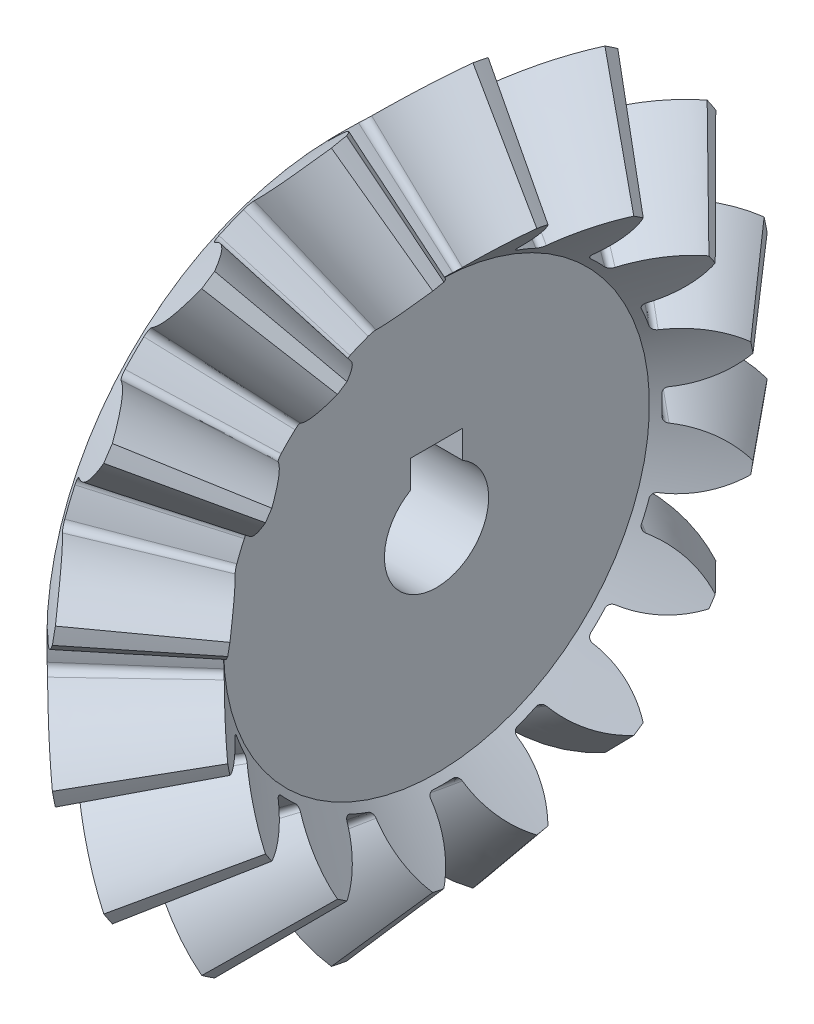
from build123d import *

# Parameters (mm, degrees)
TEETHCUTS_COUNT    = 16
TEETHCUTS_ANGLE    = 337.5
HUBSKE_R           = 27.798901836
HUB_DEPTH          = 0.0001016
BORSKE_R           = 5
BORE_DEPTH         = 36.201148964
SKETCH2_W          = 5
SKETCH2_H          = 5
CUT_EXTRUDE2_DEPTH = 50


with BuildPart() as part:
    # BasProSke → Base-Revolve (revolve)
    with BuildSketch(Plane(origin=(0, 0, 0), x_dir=(1, 0, 0), z_dir=(0, 1, 0)), mode=Mode.PRIVATE) as base_revolve_sk:
        Polygon((0, 0), (0, 27.79890184), (7.029525295, 34.828427122), (14.76480666, 25.59314574), (9.599265744, 20.427604833), (9.599265744, 0), align=None)
    revolve(base_revolve_sk.sketch.rotate(Axis((-10, 0, 0), (1, 0, 0)), 180), axis=Axis((-10, 0, 0), (1, 0, 0)))

    # ToothCut: read off the stored shape, not the designer's step
    # ToothCut: loft between two sections, ruled curve by curve
    toothcut_from = [
        Edge.make_bspline([(36.206891829, 0.005793661, -0.009703418), (36.202752871, 0.001654704, -0.014645972), (36.197364322, -0.003733846, -0.013859942), (36.194025889, -0.007072278, -0.007826658)], [0, 0, 0, 0, 1, 1, 1, 1], 3, [1, 0.79588138, 0.79588138, 1]),
        Edge.make_bspline([(36.194025889, -0.007072278, 0.007826658), (36.197364322, -0.003733846, 0.013859942), (36.202752871, 0.001654704, 0.014645972), (36.206891829, 0.005793661, 0.009703418)], [0, 0, 0, 0, 1, 1, 1, 1], 3, [1, 0.79588138, 0.79588138, 1]),
        Edge.make_bspline([(36.194025889, -0.007072278, -0.007826658), (36.193482763, -0.007615404, -0.006845109), (36.193046909, -0.008051258, -0.005761841), (36.192727687, -0.008370481, -0.004600116)], [0, 0, 0, 0, 1, 1, 1, 1], 3, [1, 0.99284125, 0.99284125, 1]),
        Edge.make_bspline([(36.192727687, -0.008370481, 0.004600116), (36.193046909, -0.008051258, 0.005761841), (36.193482763, -0.007615404, 0.006845109), (36.194025889, -0.007072278, 0.007826658)], [0, 0, 0, 0, 1, 1, 1, 1], 3, [1, 0.99284125, 0.99284125, 1]),
        Edge.make_bspline([(36.192727687, -0.008370481, -0.004600116), (36.191904976, -0.009193191, -0.001606079), (36.191904976, -0.009193191, 0.001606079), (36.192727687, -0.008370481, 0.004600116)], [0, 0, 0, 0, 1, 1, 1, 1], 3, [1, 0.954730001, 0.954730001, 1]),
        Edge.make_line((36.206891829, 0.005793661, 0.009703418), (36.206891829, 0.005793661, -0.009703418)),
    ]
    toothcut_to = [
        Edge.make_bspline([(7.109764347, 34.908666175, -6.646451093), (5.632990485, 33.431892315, -4.092410632), (3.594649708, 31.393551541, -2.487674356), (1.281610641, 29.080512478, -2.058086977)], [0, 0, 0, 0, 1, 1, 1, 1], 3, [1, 0.953087886, 0.953087886, 1]),
        Edge.make_bspline([(1.281610641, 29.080512478, 2.058086977), (3.594649708, 31.393551541, 2.487674356), (5.632990485, 33.431892315, 4.092410632), (7.109764347, 34.908666175, 6.646451093)], [0, 0, 0, 0, 1, 1, 1, 1], 3, [1, 0.953087886, 0.953087886, 1]),
        Edge.make_bspline([(1.281610641, 29.080512478, -2.058086977), (0.992514696, 28.791416534, -2.004394858), (0.805416205, 28.604318044, -1.688129016), (0.819073498, 28.617975336, -1.276227656)], [0, 0, 0, 0, 1, 1, 1, 1], 3, [1, 0.824052866, 0.824052866, 1]),
        Edge.make_bspline([(0.819073498, 28.617975336, 1.276227656), (0.805416205, 28.604318044, 1.688129016), (0.992514696, 28.791416534, 2.004394858), (1.281610641, 29.080512478, 2.058086977)], [0, 0, 0, 0, 1, 1, 1, 1], 3, [1, 0.824052866, 0.824052866, 1]),
        Edge.make_bspline([(0.819073498, 28.617975336, -1.276227656), (0.847273507, 28.646175345, -0.425720721), (0.847273507, 28.646175345, 0.425720721), (0.819073498, 28.617975336, 1.276227656)], [0, 0, 0, 0, 1, 1, 1, 1], 3, [1, 0.999268295, 0.999268295, 1]),
        Edge.make_line((7.109764347, 34.908666175, 6.646451093), (7.109764347, 34.908666175, -6.646451093)),
    ]
    toothcut = Solid(Shell([*[Face.make_surface_from_curves(toothcut_from[k], toothcut_to[k]) for k in range(6)], Face(Wire(toothcut_from)), Face(Wire(toothcut_to))]))
    add(toothcut, mode=Mode.SUBTRACT)

    # TeethCuts: ToothCut ×16 about axis
    teethcuts_axis = Axis((-10, 0, 0), (1, 0, 0))
    for i in range(1, TEETHCUTS_COUNT):
        add(toothcut.rotate(teethcuts_axis, i * TEETHCUTS_ANGLE / (TEETHCUTS_COUNT - 1)), mode=Mode.SUBTRACT)

    # HubSke → Hub (add)
    with BuildSketch(Plane.ZY):
        Circle(HUBSKE_R)
    extrude(amount=HUB_DEPTH)

    # BorSke → Bore (cut, symmetric)
    with BuildSketch(Plane(origin=(0, 0, 0), x_dir=(0, 0, -1), z_dir=(1, 0, 0))):
        with Locations(Location((0, 0, 0), (0, 0, 180))):
            Circle(BORSKE_R)
    extrude(amount=BORE_DEPTH, both=True, mode=Mode.SUBTRACT)

    # Sketch2 → Cut-Extrude2 (cut)
    with BuildSketch(Plane.ZY.offset(0.0001016)):
        with Locations((0, 4.5)):
            Rectangle(SKETCH2_W, SKETCH2_H)
    extrude(amount=-CUT_EXTRUDE2_DEPTH, mode=Mode.SUBTRACT)


solid = part.part
